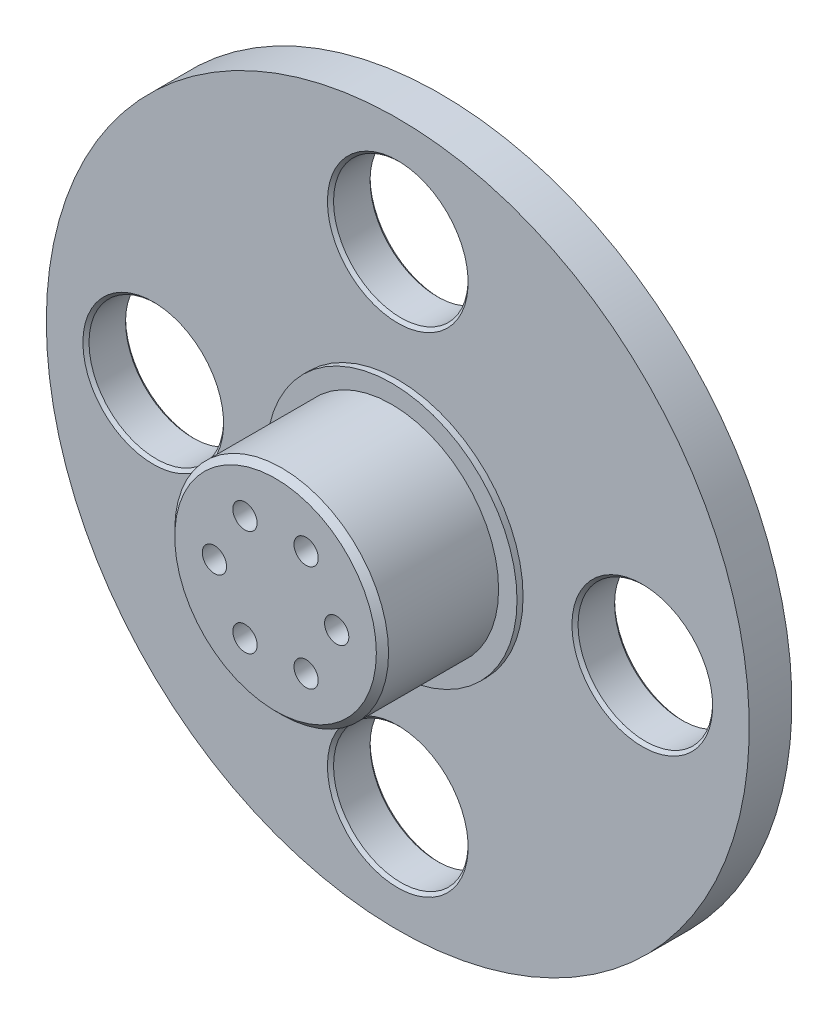
from build123d import *

# Parameters (mm, degrees)
SKETCH1_R                    = 17.49
BOSS_EXTRUDE1_DEPTH          = 19
SKETCH7_R                    = 20.5
BOSS_EXTRUDE3_DEPTH          = 0.995
SKETCH3_R                    = 57.5
BOSS_EXTRUDE2_DEPTH          = 6.975
SKETCH4_R                    = 11.015
CUT_EXTRUDE1_DEPTH           = 7
SKETCH5_R                    = 7.5
CUT_EXTRUDE2_DEPTH           = 0.5
SKETCH6_R                    = 1.985
CUT_EXTRUDE3_DEPTH           = 10
CIRPATTERN1_COUNT            = 6
CHAMFER1_SIZE                = 1
SKETCH12_R                   = 11.01
CUT_EXTRUDE7_DEPTH           = 84.7394771
CHAMFER5_SIZE                = 0.5
CIRPATTERN4_COUNT            = 4
CHAMFER5_OF_CIRPATTERN4_SIZE = 0.5


with BuildPart() as part:
    # Sketch1 → Boss-Extrude1 (new body)
    with BuildSketch(Plane.XY):
        Circle(SKETCH1_R)
    extrude(amount=BOSS_EXTRUDE1_DEPTH)

    # Sketch7 → Boss-Extrude3 (add)
    with BuildSketch(Plane(origin=(0, 0, 0), x_dir=(-1, 0, 0), z_dir=(0, 0, -1))):
        Circle(SKETCH7_R)
    extrude(amount=BOSS_EXTRUDE3_DEPTH)

    # Sketch3 → Boss-Extrude2 (add)
    with BuildSketch(Plane(origin=(0, 0, -0.995), x_dir=(-1, 0, 0), z_dir=(0, 0, -1))):
        Circle(SKETCH3_R)
    extrude(amount=BOSS_EXTRUDE2_DEPTH)

    # Sketch4 → Cut-Extrude1 (cut)
    with BuildSketch(Plane(origin=(0, 0, -7.97), x_dir=(-1, 0, 0), z_dir=(0, 0, -1))):
        Circle(SKETCH4_R)
    extrude(amount=-CUT_EXTRUDE1_DEPTH, mode=Mode.SUBTRACT)

    # Sketch5 → Cut-Extrude2 (cut)
    with BuildSketch(Plane(origin=(0, 0, -0.97), x_dir=(-1, 0, 0), z_dir=(0, 0, -1))):
        Circle(SKETCH5_R)
    extrude(amount=-CUT_EXTRUDE2_DEPTH, mode=Mode.SUBTRACT)

    # Sketch6 → Cut-Extrude3 (cut)
    with BuildSketch(Plane.XY.offset(19)):
        with Locations((-10, 0)):
            Circle(SKETCH6_R)
    cut_extrude3 = extrude(amount=-CUT_EXTRUDE3_DEPTH, mode=Mode.SUBTRACT)

    # CirPattern1: Cut-Extrude3 ×6 about axis
    cirpattern1_axis = Axis((0, 0, 19), (0, 0, 1))
    for i in range(1, CIRPATTERN1_COUNT):
        add(cut_extrude3.rotate(cirpattern1_axis, i * 360 / CIRPATTERN1_COUNT), mode=Mode.SUBTRACT)

    # Chamfer1
    chamfer1_edges = [part.edges().sort_by_distance(p)[0] for p in [
        (11.015, 0, -7.97),
        (-17.49, 0, 19),
    ]]
    chamfer(chamfer1_edges, length=CHAMFER1_SIZE)

    # Sketch12 → Cut-Extrude7 (cut, through all)
    with BuildSketch(Plane.XY.offset(-0.995)):
        with Locations((-40, 0)):
            Circle(SKETCH12_R)
    cut_extrude7 = extrude(amount=-CUT_EXTRUDE7_DEPTH, mode=Mode.SUBTRACT)

    # Chamfer5
    chamfer5_edges = [part.edges().sort_by_distance(p)[0] for p in [
        (-51.01, 0, -7.97),
        (-51.01, 0, -0.995),
    ]]
    chamfer(chamfer5_edges, length=CHAMFER5_SIZE)

    # CirPattern4: Cut-Extrude7 ×4 about axis
    cirpattern4_axis = Axis((0, 0, -7.97), (0, 0, 1))
    for i in range(1, CIRPATTERN4_COUNT):
        add(cut_extrude7.rotate(cirpattern4_axis, i * 360 / CIRPATTERN4_COUNT), mode=Mode.SUBTRACT)

    # Chamfer5 of CirPattern4
    chamfer5_of_cirpattern4_edges = [part.edges().sort_by_distance(p)[0] for p in [
        (0, -51.01, -7.97),
        (0, -51.01, -0.995),
        (51.01, 0, -7.97),
        (51.01, 0, -0.995),
        (0, 51.01, -7.97),
        (0, 51.01, -0.995),
    ]]
    chamfer(chamfer5_of_cirpattern4_edges, length=CHAMFER5_OF_CIRPATTERN4_SIZE)


solid = part.part
